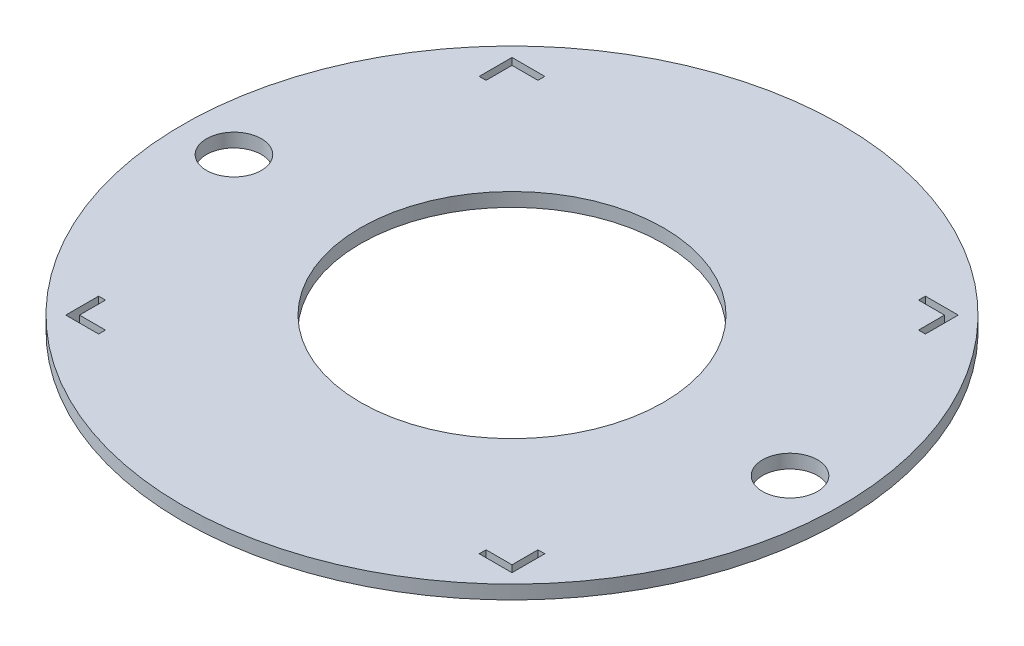
from build123d import *

# Parameters (mm, degrees)
SKETCH1_R           = 76.2
BOSS_EXTRUDE1_DEPTH = 3.175
SKETCH2_R           = 35
CUT_EXTRUDE1_DEPTH  = 3.175
SKETCH3_R           = 6.35
CUT_EXTRUDE2_DEPTH  = 10


with BuildPart() as part:
    # Sketch1 → Boss-Extrude1 (new body)
    with BuildSketch(Plane(origin=(0, 0, 0), x_dir=(1, 0, 0), z_dir=(0, 1, 0))):
        Circle(SKETCH1_R)
        Polygon((-50, 50), (-50, 44), (-51.5875, 44), (-51.5875, 51.5875), (-44, 51.5875), (-44, 50), align=None, mode=Mode.SUBTRACT)
        Polygon((51.5875, -44), (50, -44), (50, -50), (44, -50), (44, -51.5875), (51.5875, -51.5875), align=None, mode=Mode.SUBTRACT)
        Polygon((-50, -50), (-44, -50), (-44, -51.5875), (-51.5875, -51.5875), (-51.5875, -44), (-50, -44), align=None, mode=Mode.SUBTRACT)
        Polygon((51.5875, 51.5875), (44, 51.5875), (44, 50), (50, 50), (50, 44), (51.5875, 44), align=None, mode=Mode.SUBTRACT)
    extrude(amount=BOSS_EXTRUDE1_DEPTH)

    # Sketch2 → Cut-Extrude1 (cut)
    with BuildSketch(Plane(origin=(0, 3.175, 0), x_dir=(1, 0, 0), z_dir=(0, 1, 0))):
        Circle(SKETCH2_R)
    extrude(amount=-CUT_EXTRUDE1_DEPTH, mode=Mode.SUBTRACT)

    # Sketch3 → Cut-Extrude2 (cut)
    with BuildSketch(Plane(origin=(0, 3.175, 0), x_dir=(1, 0, 0), z_dir=(0, 1, 0))):
        with Locations((-64.2875, 0)):
            Circle(SKETCH3_R)
        with Locations((64.2875, 0)):
            Circle(SKETCH3_R)
    extrude(amount=-CUT_EXTRUDE2_DEPTH, mode=Mode.SUBTRACT)


solid = part.part
